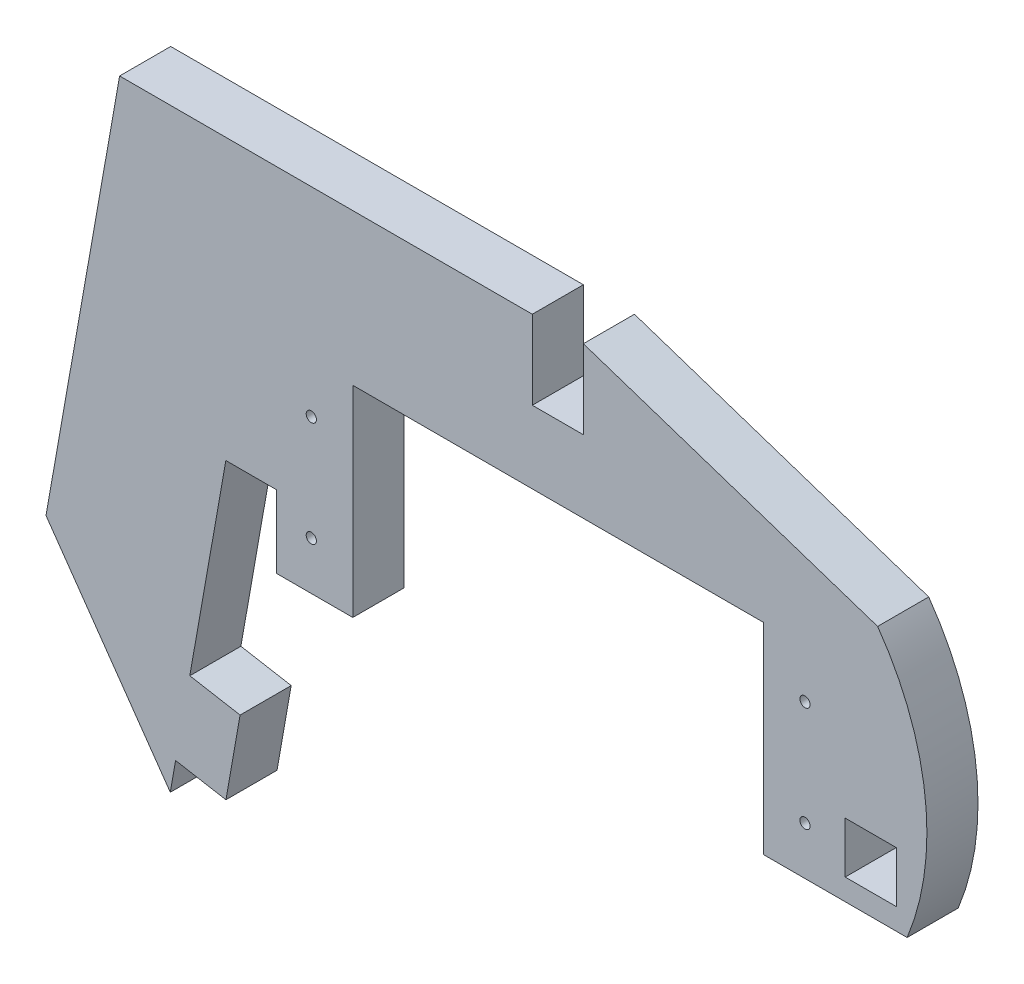
from build123d import *

# Parameters (mm, degrees)
BOSS_EXTRU_1_DEPTH      = 5
ESQUISSE2_R             = 0.5
ESQUISSE2_W             = 5
ESQUISSE2_H             = 5
ESQUISSE2_H_2           = 7.716636706
ENL_V_MAT_EXTRU_1_DEPTH = 5


with BuildPart() as part:
    # Esquisse1 → Boss.-Extru.1 (new body)
    with BuildSketch(Plane.XY):
        Polygon((0, 0), (0, -19.685), (20, -19.685), (20, 2.315), (-17.629364869, 14.809136706), (-63.027846181, 14.809136706), (-70.234197757, -26.060113977), (-54.01100625, -49.22923259), (-48.80156092, -19.685), (-40.2, -19.685), (-40.2, 0), align=None)
    extrude(amount=BOSS_EXTRU_1_DEPTH)

    # Esquisse2 → Enlèv. mat.-Extru.1 (cut)
    with BuildSketch(Plane(origin=(0, 0, 0), x_dir=(-1, 0, 0), z_dir=(0, 0, -1))):
        with Locations((-4.064, -14.986)):
            Circle(ESQUISSE2_R)
        with Locations((-4.064, -4.699)):
            Circle(ESQUISSE2_R)
        with Locations((44.264, -14.986)):
            Circle(ESQUISSE2_R)
        with Locations((44.264, -4.699)):
            Circle(ESQUISSE2_R)
        with BuildLine():
            Line((-11.174422585, 5.245370234), (-11.997659033, 9.914176137))
            Line((-11.997659033, 9.914176137), (-30.732234233, 6.610765057))
            Line((-30.732234233, 6.610765057), (-25.732815565, -21.742347141))
            Line((-25.732815565, -21.742347141), (-14.065020128, -19.685))
            ThreePointArc((-14.065020128, -19.685), (-15.826974934, -6.847943979), (-11.174422585, 5.245370234))
        make_face()
        with Locations((-10.5, -15.0925)):
            Rectangle(ESQUISSE2_W, ESQUISSE2_H)
        with Locations((20.129364869, 10.950818353)):
            Rectangle(ESQUISSE2_W, ESQUISSE2_H_2)
        Polygon((47.693, -34.096441766), (47.693, -12.5925), (52.628094869, -12.5925), (56.156674173, -32.604067654), align=None)
        Polygon((57.545859594, -40.482529678), (58.935045015, -48.360991702), (54.01100625, -49.22923259), (52.621820829, -41.350770566), align=None)
    extrude(amount=-ENL_V_MAT_EXTRU_1_DEPTH, mode=Mode.SUBTRACT)


solid = part.part
